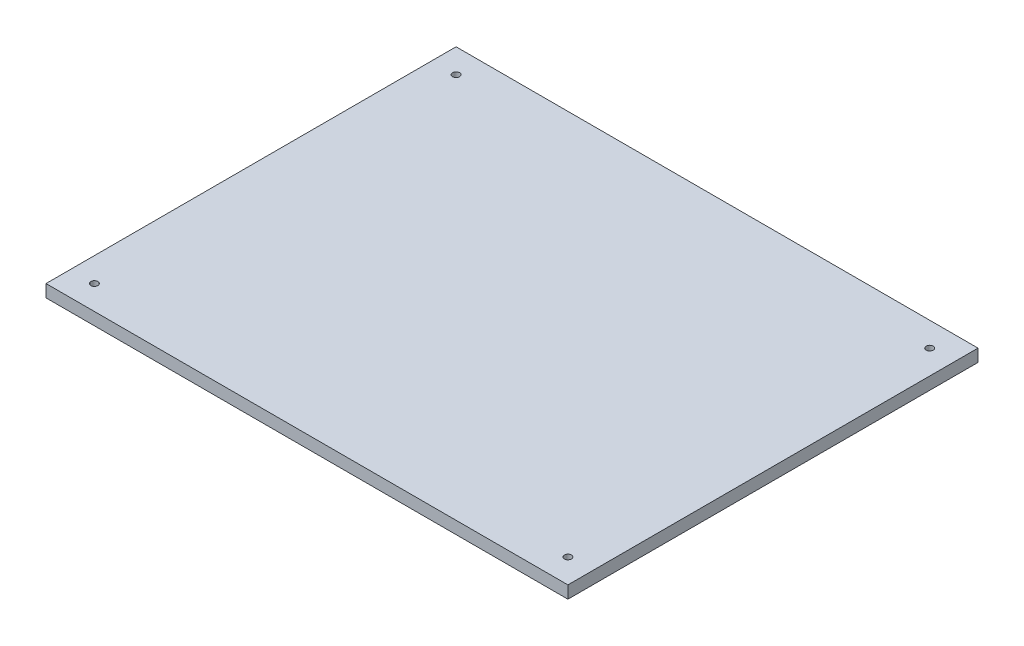
from build123d import *

# Parameters (mm, degrees)
SKETCH1_W            = 266.7
SKETCH1_H            = 209.55
BOSS_EXTRUDE1_DEPTH  = 6.35
M3_CLEARANCE_HOLE1_D = 3.6


with BuildPart() as part:
    # Sketch1 → Boss-Extrude1 (new body)
    with BuildSketch(Plane(origin=(0, 0, 0), x_dir=(1, 0, 0), z_dir=(0, 1, 0))):
        Rectangle(SKETCH1_W, SKETCH1_H)
    extrude(amount=BOSS_EXTRUDE1_DEPTH)

    # M3 Clearance Hole1 (through all)
    with Locations(Plane(origin=(0, 6.35, 0), x_dir=(1, 0, 0), z_dir=(0, 1, 0))):
        with Locations((121.0056, -92.4306), (-121.0056, -92.4306), (-121.0056, 92.4306), (121.0056, 92.4306)):
            Hole(M3_CLEARANCE_HOLE1_D / 2)


solid = part.part
